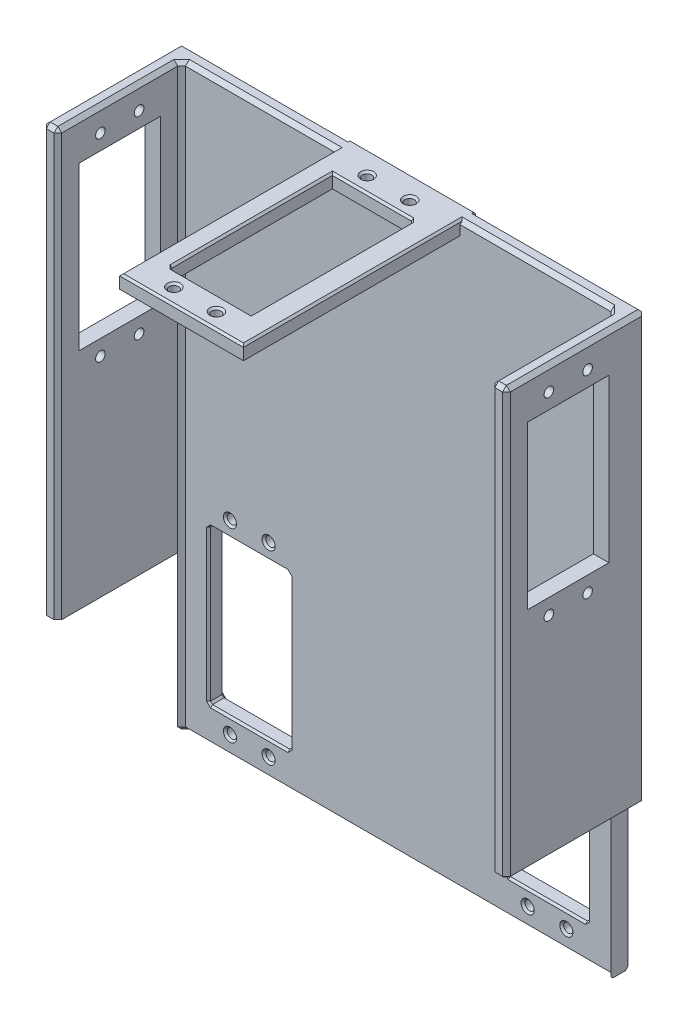
from build123d import *

# Parameters (mm, degrees)
SKETCH1_W                = 120
SKETCH1_H                = 150
BOSS_EXTRUDE1_DEPTH      = 4
SKETCH2_W                = 32
SKETCH2_H                = 150
BOSS_EXTRUDE2_DEPTH      = 4
CUT_EXTRUDE1_DEPTH       = 147.017122284
CUT_EXTRUDE1_DEPTH_BACK  = 147.017122284
SKETCH3_R                = 1.25
SKETCH3_W                = 21
SKETCH3_H                = 42
CHAMFER1_SIZE            = 1
CHAMFER2_SIZE            = 1
SKETCH4_R                = 1.2
SKETCH4_W                = 21
SKETCH4_H                = 40
CUT_EXTRUDE2_DEPTH       = 10
CHAMFER3_SIZE            = 0.5
CHAMFER3_OF_MIRROR2_SIZE = 0.5
SKETCH5_W                = 36
SKETCH5_H                = 40
CUT_EXTRUDE3_DEPTH       = 4
CHAMFER4_SIZE            = 0.5
SKETCH7_W                = 32
SKETCH7_H                = 60
BOSS_EXTRUDE3_DEPTH      = 4
SKETCH8_R                = 1.2
SKETCH8_W                = 21
SKETCH8_H                = 42
CUT_EXTRUDE4_DEPTH       = 4
CHAMFER5_SIZE            = 0.5
CHAMFER6_SIZE            = 1


with BuildPart() as part:
    # Sketch1 → Boss-Extrude1 (new body)
    with BuildSketch(Plane.XY):
        Rectangle(SKETCH1_W, SKETCH1_H)
    extrude(amount=BOSS_EXTRUDE1_DEPTH)

    # Sketch2 → Boss-Extrude2 (add)
    with BuildSketch(Plane(origin=(60, 0, 0), x_dir=(0, 0, -1), z_dir=(1, 0, 0))):
        with Locations((-20, 0)):
            Rectangle(SKETCH2_W, SKETCH2_H)
    boss_extrude2 = extrude(amount=-BOSS_EXTRUDE2_DEPTH)

    # Mirror1: Boss-Extrude2 across plane
    add(boss_extrude2.mirror(Plane(origin=(0, 0, 0), x_dir=(0, 0, 1), z_dir=(1, 0, 0))))

    # Sketch3 → Cut-Extrude1 (cut, two sides: drawn at the far end of the back side and taken through both)
    with BuildSketch(Plane(origin=(60, 0, 0), x_dir=(0, 0, -1), z_dir=(1, 0, 0)).offset(-CUT_EXTRUDE1_DEPTH_BACK)):
        with Locations(Location((-25, 69, 0), (0, 0, 90))):
            Circle(SKETCH3_R)
        with Locations(Location((-15, 69, 0), (0, 0, 90))):
            Circle(SKETCH3_R)
        with Locations(Location((-25, 19, 0), (0, 0, 90))):
            Circle(SKETCH3_R)
        with Locations(Location((-15, 19, 0), (0, 0, 90))):
            Circle(SKETCH3_R)
        with Locations((-20, 44)):
            Rectangle(SKETCH3_W, SKETCH3_H)
    extrude(amount=CUT_EXTRUDE1_DEPTH + CUT_EXTRUDE1_DEPTH_BACK, mode=Mode.SUBTRACT)

    # Chamfer1
    chamfer1_edges = [part.edges().sort_by_distance(p)[0] for p in [
        (0, -75, 0),
        (-60, 0, 0),
        (0, 75, 0),
        (60, 0, 0),
    ]]
    chamfer(chamfer1_edges, length=CHAMFER1_SIZE)

    # Chamfer2
    chamfer2_edges = [part.edges().sort_by_distance(p)[0] for p in [
        (0, 75, 4),
        (56, 0, 4),
        (56, -75, 20),
        (56, 0, 36),
        (58, -75, 36),
        (56, 75, 20),
        (58, 75, 36),
        (60, 0, 36),
        (0, -75, 4),
        (-60, 0, 36),
        (-58, 75, 36),
        (-58, -75, 36),
        (-56, 0, 4),
        (-56, 75, 20),
        (-56, 0, 36),
        (-56, -75, 20),
        (60, -75, 18.5),
        (-60, -75, 18.5),
        (-60, 75, 18.5),
        (60, 75, 18.5),
    ]]
    chamfer(chamfer2_edges, length=CHAMFER2_SIZE)

    # Sketch4 → Cut-Extrude2 (cut)
    with BuildSketch(Plane.XY.offset(4)):
        with Locations((43.5, -70)):
            Circle(SKETCH4_R)
        with Locations((33.5, -70)):
            Circle(SKETCH4_R)
        with Locations((33.5, -22)):
            Circle(SKETCH4_R)
        with Locations((43.5, -22)):
            Circle(SKETCH4_R)
        with Locations((38.5, -46)):
            Rectangle(SKETCH4_W, SKETCH4_H)
    cut_extrude2 = extrude(amount=-CUT_EXTRUDE2_DEPTH, mode=Mode.SUBTRACT)

    # Chamfer3
    chamfer3_edges = [part.edges().sort_by_distance(p)[0] for p in [
        (38.5, -66, 0),
        (49, -46, 0),
        (38.5, -26, 0),
        (28, -46, 0),
        (42.3, -22, 0),
        (42.3, -22, 4),
        (32.3, -22, 0),
        (32.3, -22, 4),
        (32.3, -70, 0),
        (32.3, -70, 4),
        (42.3, -70, 0),
        (42.3, -70, 4),
        (28, -66, 2),
        (28, -26, 2),
        (49, -26, 2),
        (49, -66, 2),
        (28, -46, 4),
        (38.5, -66, 4),
        (49, -46, 4),
        (38.5, -26, 4),
    ]]
    chamfer(chamfer3_edges, length=CHAMFER3_SIZE)

    # Mirror2: Cut-Extrude2 across plane
    add(cut_extrude2.mirror(Plane(origin=(0, 0, 0), x_dir=(0, 0, 1), z_dir=(1, 0, 0))), mode=Mode.SUBTRACT)

    # Chamfer3 of Mirror2
    chamfer3_of_mirror2_edges = [part.edges().sort_by_distance(p)[0] for p in [
        (-38.5, -66, 0),
        (-49, -46, 0),
        (-38.5, -26, 0),
        (-28, -46, 0),
        (-42.3, -22, 0),
        (-42.3, -22, 4),
        (-32.3, -22, 0),
        (-32.3, -22, 4),
        (-32.3, -70, 0),
        (-32.3, -70, 4),
        (-42.3, -70, 0),
        (-42.3, -70, 4),
        (-28, -66, 2),
        (-28, -26, 2),
        (-49, -26, 2),
        (-49, -66, 2),
        (-28, -46, 4),
        (-38.5, -66, 4),
        (-49, -46, 4),
        (-38.5, -26, 4),
    ]]
    chamfer(chamfer3_of_mirror2_edges, length=CHAMFER3_OF_MIRROR2_SIZE)

    # Sketch5 → Cut-Extrude3 (cut)
    with BuildSketch(Plane(origin=(60, 0, 0), x_dir=(0, 0, -1), z_dir=(1, 0, 0))):
        with Locations((-18, -55)):
            Rectangle(SKETCH5_W, SKETCH5_H)
    cut_extrude3 = extrude(amount=-CUT_EXTRUDE3_DEPTH, mode=Mode.SUBTRACT)

    # Chamfer4
    chamfer4_edges = [part.edges().sort_by_distance(p)[0] for p in [
        (56, -35, 20),
        (56.5, -35, 35.5),
        (58, -35, 36),
        (59.5, -35, 35.5),
        (60, -35, 18),
        (59.5, -35, 0.5),
        (57.5, -35, 0),
        (56, -54.5, 0),
        (56, -74.5, 0.5),
        (56, -75, 2.5),
    ]]
    chamfer(chamfer4_edges, length=CHAMFER4_SIZE)

    # Mirror3: Cut-Extrude3 across plane
    add(cut_extrude3.mirror(Plane(origin=(0, 0, 0), x_dir=(0, 0, 1), z_dir=(1, 0, 0))), mode=Mode.SUBTRACT)

    # Sketch7 → Boss-Extrude3 (add)
    with BuildSketch(Plane(origin=(0, 75, 0), x_dir=(1, 0, 0), z_dir=(0, 1, 0))):
        with Locations((0, -30)):
            Rectangle(SKETCH7_W, SKETCH7_H)
    extrude(amount=-BOSS_EXTRUDE3_DEPTH)

    # Sketch8 → Cut-Extrude4 (cut)
    with BuildSketch(Plane(origin=(0, 75, 0), x_dir=(1, 0, 0), z_dir=(0, 1, 0))):
        with Locations(Location((-6, -6, 0), (0, 0, 270))):
            Circle(SKETCH8_R)
        with Locations(Location((5, -6, 0), (0, 0, 270))):
            Circle(SKETCH8_R)
        with Locations(Location((-6, -56, 0), (0, 0, 270))):
            Circle(SKETCH8_R)
        with Locations(Location((5, -56, 0), (0, 0, 270))):
            Circle(SKETCH8_R)
        with Locations((-0.5, -31)):
            Rectangle(SKETCH8_W, SKETCH8_H)
    extrude(amount=-CUT_EXTRUDE4_DEPTH, mode=Mode.SUBTRACT)

    # Chamfer5
    chamfer5_edges = [part.edges().sort_by_distance(p)[0] for p in [
        (5, 75, 4.8),
        (-6, 75, 4.8),
        (-6, 71, 54.8),
        (5, 71, 54.8),
        (5, 75, 54.8),
        (-6, 75, 54.8),
        (16, 71, 32),
        (0, 71, 60),
        (-16, 71, 32),
        (0, 75, 0),
        (-11, 71, 31),
        (10, 73, 10),
        (-0.5, 71, 10),
        (10, 71, 31),
        (-0.5, 71, 52),
        (-11, 73, 52),
        (-11, 75, 31),
        (-0.5, 75, 52),
        (-0.5, 75, 10),
        (10, 75, 31),
        (16, 75, 31.5),
        (0, 75, 60),
        (-16, 75, 31.5),
    ]]
    chamfer(chamfer5_edges, length=CHAMFER5_SIZE)

    # Chamfer6
    # the kernel refuses this chamfer: 1 mm, written as the material it adds along each edge
    with BuildSketch(Plane(origin=(18.071682988, 71, 4), x_dir=(0, -0.9996219169112968, -0.027495876610586605), z_dir=(-1, 0, 0))) as chamfer6_piece_1_section:
        Polygon((CHAMFER6_SIZE * 0.999621916911, CHAMFER6_SIZE * 0.0274958766106), (-CHAMFER6_SIZE * 0.0274958766106, CHAMFER6_SIZE * 0.999621916911), (0, 0), align=None)
    chamfer6_piece_1 = extrude(amount=36.143365976, mode=Mode.PRIVATE)
    chamfer6_piece_1 = split(chamfer6_piece_1, bisect_by=Plane(origin=(7.587476116, 63.087476116, 4.330449697), z_dir=(-0.7071067811865476, 0.7071067811865476, 0)), keep=Keep.TOP, mode=Mode.PRIVATE)
    chamfer6_piece_1 = split(chamfer6_piece_1, bisect_by=Plane(origin=(-7.586094562, 63.086094562, 4.330449697), z_dir=(0.7071067811865476, 0.7071067811865476, 0)), keep=Keep.TOP, mode=Mode.PRIVATE)
    chamfer6_piece_1 = chamfer6_piece_1 - Plane(origin=(-6, 70.673570677, 6), x_dir=(0, 0, 1), z_dir=(0, 1, 0)) * Cylinder(1.2, 77, mode=Mode.PRIVATE)
    chamfer6_piece_1 = chamfer6_piece_1 - Plane(origin=(5, 70.673570677, 6), x_dir=(0, 0, 1), z_dir=(0, 1, 0)) * Cylinder(1.2, 77, mode=Mode.PRIVATE)
    add(chamfer6_piece_1)


solid = part.part
